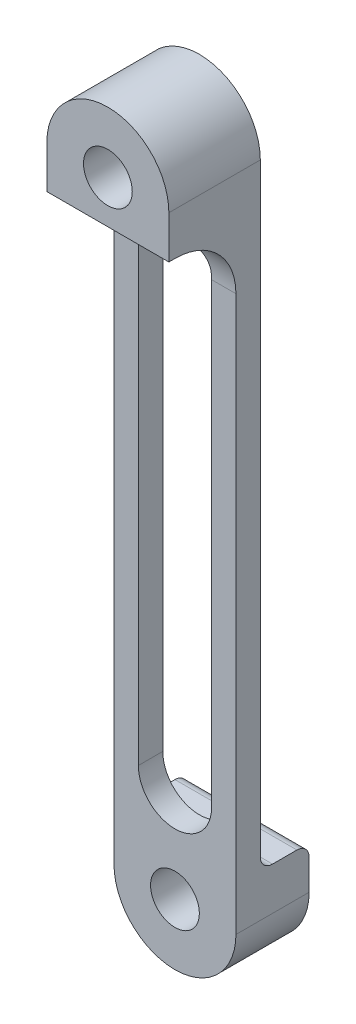
from build123d import *

# Parameters (mm, degrees)
CROQUIS1_R              = 4
SALIENTE_EXTRUIR1_DEPTH = 4
SALIENTE_EXTRUIR2_START = -8
CROQUIS1_5_R            = 4
SALIENTE_EXTRUIR2_DEPTH = 8
REDONDEO2_R             = 2
CROQUIS1_6_R            = 4
SALIENTE_EXTRUIR3_DEPTH = 15
REDONDEO1_START         = -10
REDONDEO1_DEPTH         = 4
REDONDEO1_START_2       = 6
REDONDEO1_2_DEPTH       = 4
REDONDEO1_START_3       = 4
REDONDEO1_3_DEPTH       = 10
REDONDEO1_START_4       = -6
REDONDEO1_4_DEPTH       = 12


with BuildPart() as part:
    # Croquis1 → Saliente-Extruir1 (new body)
    with BuildSketch(Plane.XY):
        with BuildLine():
            Line((10, 54), (10, -54))
            ThreePointArc((10, -54), (0, -64), (-10, -54))
            Line((-10, -54), (-10, 54))
            ThreePointArc((-10, 54), (0, 64), (10, 54))
        make_face()
        with Locations((0, -54)):
            Circle(CROQUIS1_R, mode=Mode.SUBTRACT)
        with BuildLine():
            Line((6, 38), (6, -38))
            ThreePointArc((6, -38), (0, -44), (-6, -38))
            Line((-6, -38), (-6, 38))
            ThreePointArc((-6, 38), (0, 44), (6, 38))
        make_face(mode=Mode.SUBTRACT)
    extrude(amount=SALIENTE_EXTRUIR1_DEPTH)

    # Croquis1<5> → Saliente-Extruir2 (add)
    with BuildSketch(Plane.XY.offset(SALIENTE_EXTRUIR2_START)):
        with BuildLine():
            Line((10, -54), (10, -47))
            Line((10, -47), (-10, -47))
            Line((-10, -47), (-10, -54))
            ThreePointArc((-10, -54), (0, -64), (10, -54))
        make_face()
        with Locations((0, -54)):
            Circle(CROQUIS1_5_R, mode=Mode.SUBTRACT)
    extrude(amount=SALIENTE_EXTRUIR2_DEPTH)

    # Redondeo2
    redondeo2_edges = [part.edges().sort_by_distance(p)[0] for p in [
        (0, -47, 0),
        (0, -47, -8),
    ]]
    fillet(redondeo2_edges, radius=REDONDEO2_R)

    # Croquis1<6> → Saliente-Extruir3 (add)
    with BuildSketch(Plane.XY):
        with BuildLine():
            Line((10, 47), (10, 54))
            ThreePointArc((10, 54), (0, 64), (-10, 54))
            Line((-10, 54), (-10, 47))
            Line((-10, 47), (10, 47))
        make_face()
        with Locations((0, 54)):
            Circle(CROQUIS1_6_R, mode=Mode.SUBTRACT)
    extrude(amount=SALIENTE_EXTRUIR3_DEPTH)

    # Redondeo1: read off the stored shape, not the designer's step
    # Redondeo1 outline → Redondeo1 (add)
    with BuildSketch(Plane.YZ.offset(REDONDEO1_START)):
        with BuildLine():
            Line((47, 4), (47, 14))
            ThreePointArc((47, 14), (44.071067812, 6.928932188), (37, 4))
            Line((37, 4), (47, 4))
        make_face()
    extrude(amount=REDONDEO1_DEPTH)

    # Redondeo1 2 outline → Redondeo1 2 (add)
    with BuildSketch(Plane.YZ.offset(REDONDEO1_START_2)):
        with BuildLine():
            Line((47, 4), (47, 14))
            ThreePointArc((47, 14), (44.071067812, 6.928932188), (37, 4))
            Line((37, 4), (47, 4))
        make_face()
    extrude(amount=REDONDEO1_2_DEPTH)

    # Redondeo1 3 outline → Redondeo1 3 (add)
    with BuildSketch(Plane.XY.offset(REDONDEO1_START_3)):
        with BuildLine():
            Line((-6, 47), (-6, 38))
            ThreePointArc((-6, 38), (0, 44), (6, 38))
            Line((6, 38), (6, 47))
            Line((6, 47), (-6, 47))
        make_face()
    extrude(amount=REDONDEO1_3_DEPTH)

    # Redondeo1 4 outline → Redondeo1 4 (cut)
    with BuildSketch(Plane.YZ.offset(REDONDEO1_START_4)):
        with BuildLine():
            ThreePointArc((37, 4), (44.071067812, 6.928932188), (47, 14))
            Line((47, 14), (37, 14))
            Line((37, 14), (37, 4))
        make_face()
    extrude(amount=REDONDEO1_4_DEPTH, mode=Mode.SUBTRACT)


solid = part.part
